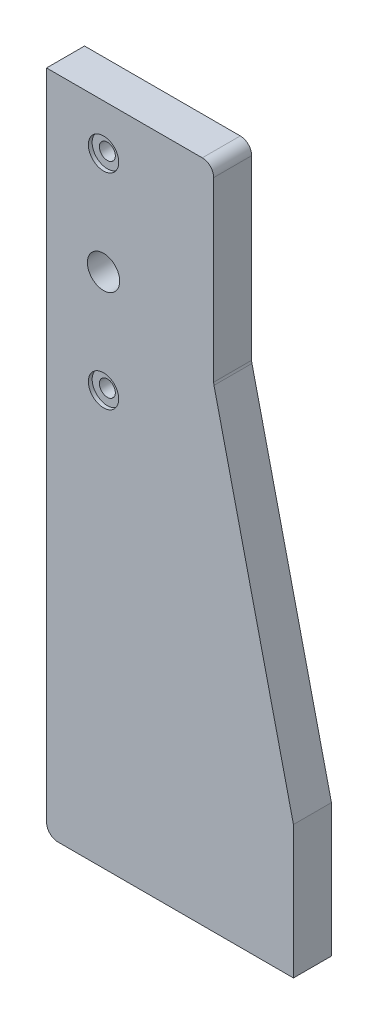
from build123d import *

# Parameters (mm, degrees)
EXTRUDE_1_DEPTH     = 10
SKETCH_6_R          = 2.1
CUT_EXTRUDE_5_DEPTH = 187.949190958
SKETCH_7_R          = 4
CUT_EXTRUDE_6_DEPTH = 1
FILLET_1_R          = 3
SKETCH_8_R          = 4.25
CUT_EXTRUDE_7_DEPTH = 10


with BuildPart() as part:
    # 草图5 → 凸台-拉伸1 (new body)
    with BuildSketch(Plane.XY):
        Polygon((0, 0), (0, 175), (44, 175), (44, 125), (65, 35), (65, 0), align=None)
    extrude(amount=EXTRUDE_1_DEPTH)

    # 草图6 → 切除-拉伸5 (cut, through all)
    with BuildSketch(Plane.XY.offset(10)):
        with Locations((15, 163)):
            Circle(SKETCH_6_R)
        with Locations((15, 109)):
            Circle(SKETCH_6_R)
    extrude(amount=-CUT_EXTRUDE_5_DEPTH, mode=Mode.SUBTRACT)

    # 草图7 → 切除-拉伸6 (cut)
    with BuildSketch(Plane.XY.offset(10)):
        with Locations((15, 163)):
            Circle(SKETCH_7_R)
        with Locations((15, 109)):
            Circle(SKETCH_7_R)
    extrude(amount=-CUT_EXTRUDE_6_DEPTH, mode=Mode.SUBTRACT)

    # 圆角1
    fillet_1_edges = [part.edges().sort_by_distance(p)[0] for p in [
        (0, 0, 5),
        (44, 125, 5),
        (44, 175, 5),
    ]]
    fillet(fillet_1_edges, radius=FILLET_1_R)

    # 草图8 → 切除-拉伸7 (cut)
    with BuildSketch(Plane.XY.offset(10)):
        with Locations((15, 136)):
            Circle(SKETCH_8_R)
    extrude(amount=-CUT_EXTRUDE_7_DEPTH, mode=Mode.SUBTRACT)


solid = part.part
